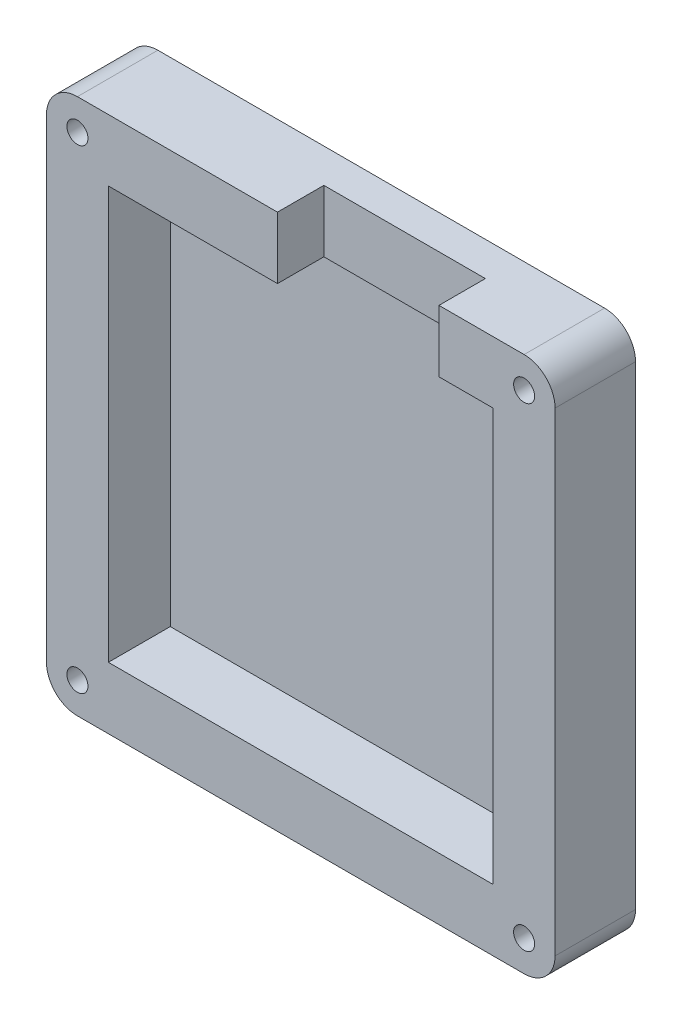
from build123d import *

# Parameters (mm, degrees)
BOSS_EXTRUDE4_START   = 3.1
SKETCH2_R             = 3
SKETCH2_R_2           = 1.7
BOSS_EXTRUDE4_DEPTH   = 9.9
BOSS_EXTRUDE4_2_DEPTH = 9.9
BOSS_EXTRUDE4_3_DEPTH = 9.9
BOSS_EXTRUDE4_4_DEPTH = 9.9
SKETCH2_12_W          = 82.193
SKETCH2_12_H          = 86.675
SKETCH2_12_R          = 3
SKETCH2_12_W_2        = 62.193
SKETCH2_12_H_2        = 66.675
BOSS_EXTRUDE5_DEPTH   = 13
SKETCH2_13_W          = 62.193
SKETCH2_13_H          = 66.675
BOSS_EXTRUDE6_DEPTH   = 3
SKETCH5_W             = 26.09775054
SKETCH5_H             = 10
CUT_EXTRUDE1_DEPTH    = 7.5
FILLET1_R             = 5
SKETCH7_W             = 0.189957265
SKETCH7_H             = 1.546794872
CUT_EXTRUDE2_DEPTH    = 0.2


with BuildPart() as part:
    # Sketch2 → Boss-Extrude4 (new body)
    with BuildSketch(Plane.XY.offset(BOSS_EXTRUDE4_START)):
        with Locations((-36.0965, 38.3375)):
            Circle(SKETCH2_R)
        with Locations((-36.0965, 38.3375)):
            Circle(SKETCH2_R_2, mode=Mode.SUBTRACT)
    extrude(amount=BOSS_EXTRUDE4_DEPTH)



with BuildPart() as body_2:
    # Sketch2 → Boss-Extrude4 2 (new body)
    with BuildSketch(Plane.XY.offset(BOSS_EXTRUDE4_START)):
        with Locations((36.0965, 38.3375)):
            Circle(SKETCH2_R)
        with Locations((36.0965, 38.3375)):
            Circle(SKETCH2_R_2, mode=Mode.SUBTRACT)
    extrude(amount=BOSS_EXTRUDE4_2_DEPTH)


with BuildPart() as body_3:
    # Sketch2 → Boss-Extrude4 3 (new body)
    with BuildSketch(Plane.XY.offset(BOSS_EXTRUDE4_START)):
        with Locations((-36.0965, -38.3375)):
            Circle(SKETCH2_R)
        with Locations((-36.0965, -38.3375)):
            Circle(SKETCH2_R_2, mode=Mode.SUBTRACT)
    extrude(amount=BOSS_EXTRUDE4_3_DEPTH)


with BuildPart() as body_4:
    # Sketch2 → Boss-Extrude4 4 (new body)
    with BuildSketch(Plane.XY.offset(BOSS_EXTRUDE4_START)):
        with Locations((36.0965, -38.3375)):
            Circle(SKETCH2_R)
        with Locations((36.0965, -38.3375)):
            Circle(SKETCH2_R_2, mode=Mode.SUBTRACT)
    extrude(amount=BOSS_EXTRUDE4_4_DEPTH)


with BuildPart() as part_1:
    add(part.part)

    add(body_2.part)  # Boss-Extrude5 merges body 2

    add(body_3.part)  # Boss-Extrude5 merges body 3

    add(body_4.part)  # Boss-Extrude5 merges body 4
    # Sketch2<12> → Boss-Extrude5 (add)
    with BuildSketch(Plane.XY):
        Rectangle(SKETCH2_12_W, SKETCH2_12_H)
        with Locations((-36.0965, -38.3375)):
            Circle(SKETCH2_12_R, mode=Mode.SUBTRACT)
        Rectangle(SKETCH2_12_W_2, SKETCH2_12_H_2, mode=Mode.SUBTRACT)
        with Locations((36.0965, -38.3375)):
            Circle(SKETCH2_12_R, mode=Mode.SUBTRACT)
        with Locations((-36.0965, 38.3375)):
            Circle(SKETCH2_12_R, mode=Mode.SUBTRACT)
        with Locations((36.0965, 38.3375)):
            Circle(SKETCH2_12_R, mode=Mode.SUBTRACT)
    extrude(amount=BOSS_EXTRUDE5_DEPTH)

    # Sketch2<13> → Boss-Extrude6 (add)
    with BuildSketch(Plane.XY):
        Rectangle(SKETCH2_13_W, SKETCH2_13_H)
    extrude(amount=BOSS_EXTRUDE6_DEPTH)

    # Sketch5 → Cut-Extrude1 (cut)
    with BuildSketch(Plane.XY.offset(13)):
        with Locations((9.28237527, 38.3375)):
            Rectangle(SKETCH5_W, SKETCH5_H)
    extrude(amount=-CUT_EXTRUDE1_DEPTH, mode=Mode.SUBTRACT)

    # Fillet1
    fillet1_edges = [part_1.edges().sort_by_distance(p)[0] for p in [
        (-41.0965, -43.3375, 6.5),
        (-41.0965, 43.3375, 6.5),
        (41.0965, -43.3375, 6.5),
        (41.0965, 43.3375, 6.5),
    ]]
    fillet(fillet1_edges, radius=FILLET1_R)

    # Sketch7 → Cut-Extrude2 (cut)
    # profile 1 of 15: a face of its own
    with BuildSketch(Plane(origin=(0, 0, 0), x_dir=(-1, 0, 0), z_dir=(0, 0, -1))):
        with BuildLine():
            Line((0.197612891, 2.170940171), (0.197612891, 0))
            Line((0.197612891, 0), (0.007655626, 0))
            Line((0.007655626, 0), (0.007655626, 0.267551416))
            add(Edge.make_bspline(
                [(0.007655626, 0.267551416), (-0.013764309, 0.243336994), (-0.055565582, 0.196082247), (-0.125379973, 0.134346838), (-0.199383585, 0.083318044), (-0.277217241, 0.042103571), (-0.358810655, 0.011144565), (-0.443982955, -0.010860398), (-0.532768886, -0.025008098), (-0.593397691, -0.026420835), (-0.624121885, -0.027136752)],
                knots=[0, 0, 0, 0, 1.074387032, 2.096679803, 3.090159297, 4.057316773, 5.018401886, 5.985159533, 6.978961417, 8, 8, 8, 8], degree=3))
            add(Edge.make_bspline(
                [(-0.624121885, -0.027136752), (-0.651437743, -0.026395089), (-0.705305824, -0.024932496), (-0.784547218, -0.01358577), (-0.860803007, 0.004636082), (-0.934145248, 0.029976144), (-1.004099355, 0.063589308), (-1.071264271, 0.10383092), (-1.135292042, 0.151752755), (-1.195206734, 0.206536944), (-1.250380373, 0.266042483), (-1.298798381, 0.329509552), (-1.3391681, 0.396663707), (-1.372925959, 0.46665471), (-1.39892851, 0.540021352), (-1.417055422, 0.616509925), (-1.42838893, 0.696029991), (-1.429850918, 0.750180084), (-1.430592237, 0.777637553)],
                knots=[0, 0, 0, 0, 1.033919861, 2.038935746, 3.024066025, 3.998881131, 4.97069526, 5.957263378, 6.95902576, 7.993208707, 9.027059324, 10.027763471, 11.009749337, 11.988697705, 12.965288445, 13.950418724, 14.960734635, 16, 16, 16, 16], degree=3))
            add(Edge.make_bspline(
                [(-1.430592237, 0.777637553), (-1.429834488, 0.804527507), (-1.428336458, 0.857687496), (-1.417176654, 0.935870328), (-1.398410282, 1.011174228), (-1.372074203, 1.083356761), (-1.338303116, 1.152505267), (-1.297222796, 1.218668654), (-1.248830278, 1.282029194), (-1.193039537, 1.341097031), (-1.132602795, 1.395659022), (-1.067948467, 1.443077825), (-1.000684864, 1.484030396), (-0.929768662, 1.516477974), (-0.856249508, 1.542730147), (-0.7794729, 1.560892942), (-0.699758279, 1.571595608), (-0.645637839, 1.57314547), (-0.61818572, 1.573931624)],
                knots=[0, 0, 0, 0, 1.020392517, 2.01726096, 2.990465484, 3.961182959, 4.928053699, 5.906110375, 6.912531644, 7.948652711, 8.985773172, 9.998621852, 10.987621588, 11.969261332, 12.953316658, 13.946091881, 14.958173133, 16, 16, 16, 16], degree=3))
            add(Edge.make_bspline(
                [(-0.61818572, 1.573931624), (-0.586606984, 1.572983904), (-0.524621435, 1.571123635), (-0.433968519, 1.555577403), (-0.348220774, 1.529474139), (-0.266884538, 1.493737983), (-0.190444714, 1.447291815), (-0.118340984, 1.391199273), (-0.05182726, 1.323872856), (-0.0124743, 1.273307761), (0.007655626, 1.247442575)],
                knots=[0, 0, 0, 0, 1.031072012, 2.023879775, 2.993683497, 3.952812103, 4.918022106, 5.908088563, 6.929940113, 8, 8, 8, 8], degree=3))
            Line((0.007655626, 1.247442575), (0.007655626, 2.170940171))
            Line((0.007655626, 2.170940171), (0.197612891, 2.170940171))
        make_face()
        with BuildLine():
            add(Edge.make_bspline(
                [(-0.61564165, 1.383974359), (-0.643408892, 1.382986397), (-0.698217012, 1.381036318), (-0.778676956, 1.365812347), (-0.855671259, 1.34048214), (-0.928814837, 1.305840228), (-0.996952283, 1.262279992), (-1.057847979, 1.209592298), (-1.111999993, 1.149214675), (-1.157543563, 1.08141959), (-1.194670197, 1.008740458), (-1.220775973, 0.932767584), (-1.237993089, 0.85487124), (-1.239752052, 0.802037616), (-1.240634972, 0.775517495)],
                knots=[0, 0, 0, 0, 1.031046209, 2.035121221, 3.029706178, 4.034933723, 5.034054252, 6.02443088, 7.017295772, 8.038157696, 9.050218397, 10.03989886, 11.016116709, 12, 12, 12, 12], degree=3))
            add(Edge.make_bspline(
                [(-1.240634972, 0.775517495), (-1.239507156, 0.749155858), (-1.237255944, 0.696535915), (-1.221078143, 0.618533375), (-1.193936505, 0.542542598), (-1.156899639, 0.469208568), (-1.110522489, 0.401121993), (-1.056766018, 0.339593443), (-0.995110372, 0.286683073), (-0.926816118, 0.242391778), (-0.853877012, 0.206612539), (-0.777172682, 0.181717129), (-0.698145034, 0.1656439), (-0.644410528, 0.16376643), (-0.617337697, 0.162820513)],
                knots=[0, 0, 0, 0, 0.979072187, 1.954306742, 2.945804271, 3.96968567, 4.997920485, 5.998718438, 6.996577872, 8.005894225, 9.015743152, 10.005417472, 10.995077863, 12, 12, 12, 12], degree=3))
            add(Edge.make_bspline(
                [(-0.617337697, 0.162820513), (-0.589853383, 0.163824396), (-0.535189809, 0.165821019), (-0.454491162, 0.181110166), (-0.376177542, 0.206370344), (-0.301315742, 0.24138553), (-0.231576939, 0.284781645), (-0.168985365, 0.335585933), (-0.116059041, 0.394673097), (-0.071190178, 0.459610285), (-0.036007902, 0.530798017), (-0.010380475, 0.60659536), (0.004771172, 0.687004956), (0.006680847, 0.741955997), (0.007655626, 0.770005342)],
                knots=[0, 0, 0, 0, 1.01762866, 2.023962475, 3.030623092, 4.058876274, 5.077231937, 6.066672613, 7.034107872, 8.005628644, 8.981990164, 9.965428785, 10.961468474, 12, 12, 12, 12], degree=3))
            add(Edge.make_bspline(
                [(0.007655626, 0.770005342), (0.007075262, 0.791376316), (0.005932923, 0.833441155), (-0.002794136, 0.895203987), (-0.016676401, 0.954309621), (-0.036238132, 1.0108202), (-0.061935242, 1.064423281), (-0.092927939, 1.115503745), (-0.129761234, 1.163795925), (-0.171842198, 1.20863483), (-0.217904011, 1.249532738), (-0.266644519, 1.286038731), (-0.31864119, 1.316028132), (-0.373019588, 1.34084833), (-0.429874062, 1.360599339), (-0.489667247, 1.373775706), (-0.551763586, 1.382823139), (-0.594124772, 1.383586579), (-0.61564165, 1.383974359)],
                knots=[0, 0, 0, 0, 1.050140795, 2.067009409, 3.05949893, 4.030605086, 5.00011959, 5.97591094, 6.962425594, 7.979863591, 8.993523472, 9.986985069, 10.967611495, 11.937549037, 12.921786183, 13.919465291, 14.943216303, 16, 16, 16, 16], degree=3))
        make_face(mode=Mode.SUBTRACT)
    # profile 2 of 15: a face of its own
    with BuildSketch(Plane(origin=(0, 0, 0), x_dir=(-1, 0, 0), z_dir=(0, 0, -1))):
        with BuildLine():
            Line((2.205732549, 1.546794872), (2.205732549, 0))
            Line((2.205732549, 0), (2.015775284, 0))
            Line((2.015775284, 0), (2.015775284, 0.267551416))
            add(Edge.make_bspline(
                [(2.015775284, 0.267551416), (1.994355349, 0.243336994), (1.952554076, 0.196082247), (1.882739685, 0.134346838), (1.808736073, 0.083318044), (1.730902417, 0.042103571), (1.649309003, 0.011144565), (1.564136703, -0.010860398), (1.475350772, -0.025008098), (1.414721967, -0.026420835), (1.383997773, -0.027136752)],
                knots=[0, 0, 0, 0, 1.074387032, 2.096679803, 3.090159297, 4.057316773, 5.018401886, 5.985159533, 6.978961417, 8, 8, 8, 8], degree=3))
            add(Edge.make_bspline(
                [(1.383997773, -0.027136752), (1.356681916, -0.026395089), (1.302813835, -0.024932496), (1.22357244, -0.01358577), (1.147316651, 0.004636082), (1.07397441, 0.029976144), (1.004020303, 0.063589308), (0.936855387, 0.10383092), (0.872827616, 0.151752755), (0.812912924, 0.206536944), (0.757739285, 0.266042483), (0.709321278, 0.329509552), (0.668951558, 0.396663707), (0.6351937, 0.46665471), (0.609191148, 0.540021352), (0.591064236, 0.616509925), (0.579730728, 0.696029991), (0.57826874, 0.750180084), (0.577527421, 0.777637553)],
                knots=[0, 0, 0, 0, 1.033919861, 2.038935746, 3.024066025, 3.998881131, 4.97069526, 5.957263378, 6.95902576, 7.993208707, 9.027059324, 10.027763471, 11.009749337, 11.988697705, 12.965288445, 13.950418724, 14.960734635, 16, 16, 16, 16], degree=3))
            add(Edge.make_bspline(
                [(0.577527421, 0.777637553), (0.57828517, 0.804527507), (0.5797832, 0.857687496), (0.590943004, 0.935870328), (0.609709376, 1.011174228), (0.636045455, 1.083356761), (0.669816542, 1.152505267), (0.710896862, 1.218668654), (0.75928938, 1.282029194), (0.815080121, 1.341097031), (0.875516863, 1.395659022), (0.940171191, 1.443077825), (1.007434795, 1.484030396), (1.078350996, 1.516477974), (1.15187015, 1.542730147), (1.228646758, 1.560892942), (1.308361379, 1.571595608), (1.362481819, 1.57314547), (1.389933938, 1.573931624)],
                knots=[0, 0, 0, 0, 1.020392517, 2.01726096, 2.990465484, 3.961182959, 4.928053699, 5.906110375, 6.912531644, 7.948652711, 8.985773172, 9.998621852, 10.987621588, 11.969261332, 12.953316658, 13.946091881, 14.958173133, 16, 16, 16, 16], degree=3))
            add(Edge.make_bspline(
                [(1.389933938, 1.573931624), (1.421502424, 1.573062127), (1.483406736, 1.571357083), (1.573956532, 1.55716772), (1.659617716, 1.533195885), (1.741051538, 1.500588636), (1.817965572, 1.457258214), (1.889631663, 1.402599857), (1.956799836, 1.336958282), (1.995734584, 1.286539013), (2.015775284, 1.260586939)],
                knots=[0, 0, 0, 0, 1.038897134, 2.037228247, 3.008116434, 3.962042015, 4.918381754, 5.904844433, 6.921570401, 8, 8, 8, 8], degree=3))
            Line((2.015775284, 1.260586939), (2.015775284, 1.546794872))
            Line((2.015775284, 1.546794872), (2.205732549, 1.546794872))
        make_face()
        with BuildLine():
            add(Edge.make_bspline(
                [(1.392478008, 1.383974359), (1.364710766, 1.382986397), (1.309902646, 1.381036318), (1.229442702, 1.365812347), (1.152448399, 1.34048214), (1.079304821, 1.305840228), (1.011167376, 1.262279992), (0.950271679, 1.209592298), (0.896119665, 1.149214675), (0.850576095, 1.08141959), (0.813449462, 1.008740458), (0.787343685, 0.932767584), (0.770126569, 0.85487124), (0.768367606, 0.802037616), (0.767484686, 0.775517495)],
                knots=[0, 0, 0, 0, 1.031046209, 2.035121221, 3.029706178, 4.034933723, 5.034054252, 6.02443088, 7.017295772, 8.038157696, 9.050218397, 10.03989886, 11.016116709, 12, 12, 12, 12], degree=3))
            add(Edge.make_bspline(
                [(0.767484686, 0.775517495), (0.768612502, 0.749155858), (0.770863714, 0.696535915), (0.787041515, 0.618533375), (0.814183153, 0.542542598), (0.85122002, 0.469208568), (0.897597169, 0.401121993), (0.95135364, 0.339593443), (1.013009286, 0.286683073), (1.08130354, 0.242391778), (1.154242646, 0.206612539), (1.230946976, 0.181717129), (1.309974624, 0.1656439), (1.363709131, 0.16376643), (1.390781961, 0.162820513)],
                knots=[0, 0, 0, 0, 0.979072187, 1.954306742, 2.945804271, 3.96968567, 4.997920485, 5.998718438, 6.996577872, 8.005894225, 9.015743152, 10.005417472, 10.995077863, 12, 12, 12, 12], degree=3))
            add(Edge.make_bspline(
                [(1.390781961, 0.162820513), (1.418266275, 0.163824396), (1.472929849, 0.165821019), (1.553628496, 0.181110166), (1.631942116, 0.206370344), (1.706803916, 0.24138553), (1.776542719, 0.284781645), (1.839134293, 0.335585933), (1.892060617, 0.394673097), (1.936929481, 0.459610285), (1.972111756, 0.530798017), (1.997739183, 0.60659536), (2.01289083, 0.687004956), (2.014800505, 0.741955997), (2.015775284, 0.770005342)],
                knots=[0, 0, 0, 0, 1.01762866, 2.023962475, 3.030623092, 4.058876274, 5.077231937, 6.066672613, 7.034107872, 8.005628644, 8.981990164, 9.965428785, 10.961468474, 12, 12, 12, 12], degree=3))
            add(Edge.make_bspline(
                [(2.015775284, 0.770005342), (2.01519492, 0.791376316), (2.014052581, 0.833441155), (2.005325522, 0.895203987), (1.991443257, 0.954309621), (1.971881526, 1.0108202), (1.946184416, 1.064423281), (1.915191719, 1.115503745), (1.878358424, 1.163795925), (1.83627746, 1.20863483), (1.790215647, 1.249532738), (1.741475139, 1.286038731), (1.689478468, 1.316028132), (1.63510007, 1.34084833), (1.578245596, 1.360599339), (1.518452412, 1.373775706), (1.456356072, 1.382823139), (1.413994886, 1.383586579), (1.392478008, 1.383974359)],
                knots=[0, 0, 0, 0, 1.050140795, 2.067009409, 3.05949893, 4.030605086, 5.00011959, 5.97591094, 6.962425594, 7.979863591, 8.993523472, 9.986985069, 10.967611495, 11.937549037, 12.921786183, 13.919465291, 14.943216303, 16, 16, 16, 16], degree=3))
        make_face(mode=Mode.SUBTRACT)
    # profile 3 of 15: a face of its own
    with BuildSketch(Plane(origin=(0, 0, 0), x_dir=(-1, 0, 0), z_dir=(0, 0, -1))):
        with BuildLine():
            Line((2.585647079, 1.546794872), (2.775604344, 1.546794872))
            Line((2.775604344, 1.546794872), (2.775604344, 1.319100561))
            add(Edge.make_bspline(
                [(2.775604344, 1.319100561), (2.789628022, 1.34030099), (2.816448197, 1.380846647), (2.861026968, 1.434470462), (2.906688507, 1.478869086), (2.953651406, 1.514249785), (3.002261019, 1.540746291), (3.051450508, 1.560154936), (3.101993769, 1.571631693), (3.135958361, 1.573163953), (3.152974803, 1.573931624)],
                knots=[0, 0, 0, 0, 1.2804753, 2.448899062, 3.506932113, 4.484331642, 5.4025378, 6.288909075, 7.142734305, 8, 8, 8, 8], degree=3))
            add(Edge.make_bspline(
                [(3.152974803, 1.573931624), (3.166174534, 1.573211639), (3.193333838, 1.571730223), (3.234447118, 1.561321772), (3.27680673, 1.54470411), (3.304107126, 1.529076928), (3.318339387, 1.520930155)],
                knots=[0, 0, 0, 0, 0.901110191, 1.854092781, 2.881294221, 4, 4, 4, 4], degree=3))
            Line((3.318339387, 1.520930155), (3.214032496, 1.356413595))
            add(Edge.make_bspline(
                [(3.214032496, 1.356413595), (3.204895135, 1.360489851), (3.187550676, 1.368227366), (3.162178153, 1.377384677), (3.138785154, 1.382776683), (3.123881668, 1.383593545), (3.116933804, 1.383974359)],
                knots=[0, 0, 0, 0, 1.180555205, 2.24091978, 3.179933427, 4, 4, 4, 4], degree=3))
            add(Edge.make_bspline(
                [(3.116933804, 1.383974359), (3.101690337, 1.382958336), (3.070598082, 1.380885945), (3.024947932, 1.36459438), (2.980650813, 1.338271973), (2.945470808, 1.309079443), (2.918230969, 1.280929109), (2.898793785, 1.256346503), (2.880963743, 1.228782283), (2.863927467, 1.198707665), (2.84840547, 1.165609139), (2.833918598, 1.129817386), (2.820820143, 1.091290951), (2.813351186, 1.064450094), (2.809525284, 1.050701122)],
                knots=[0, 0, 0, 0, 1.125678352, 2.296057538, 3.5422874, 4.923748041, 5.663163013, 6.437101912, 7.23742474, 8.08941207, 8.991984279, 9.93940061, 10.944477711, 12, 12, 12, 12], degree=3))
            add(Edge.make_bspline(
                [(2.809525284, 1.050701122), (2.806663313, 1.03843826), (2.800324264, 1.011276952), (2.79416081, 0.965709035), (2.788071149, 0.911870917), (2.783779385, 0.84961274), (2.779801236, 0.779089976), (2.777557519, 0.70019519), (2.775680858, 0.612847401), (2.775630622, 0.551781959), (2.775604344, 0.519838408)],
                knots=[0, 0, 0, 0, 0.566838948, 1.255505196, 2.06880316, 3.007127437, 4.065329342, 5.249902469, 6.561414163, 8, 8, 8, 8], degree=3))
            Line((2.775604344, 0.519838408), (2.775604344, 0))
            Line((2.775604344, 0), (2.585647079, 0))
            Line((2.585647079, 0), (2.585647079, 1.546794872))
        make_face()
    # profile 4 of 15: a face of its own
    with BuildSketch(Plane(origin=(0, 0, 0), x_dir=(-1, 0, 0), z_dir=(0, 0, -1))):
        with BuildLine():
            Line((4.240988959, 1.353869525), (4.112089387, 1.221153846))
            add(Edge.make_bspline(
                [(4.112089387, 1.221153846), (4.100967511, 1.234043225), (4.079525843, 1.25889243), (4.045519186, 1.292116275), (4.011638244, 1.320018138), (3.978346819, 1.343574981), (3.944807771, 1.361384703), (3.911414682, 1.374383976), (3.878132978, 1.382428402), (3.855886186, 1.383465229), (3.844961983, 1.383974359)],
                knots=[0, 0, 0, 0, 1.26578478, 2.440284043, 3.530471711, 4.527705817, 5.468200915, 6.346673037, 7.188140097, 8, 8, 8, 8], degree=3))
            add(Edge.make_bspline(
                [(3.844961983, 1.383974359), (3.831572923, 1.383324317), (3.805225149, 1.382045126), (3.767472392, 1.369276527), (3.732426062, 1.349676957), (3.702093031, 1.321876909), (3.676398101, 1.289967089), (3.657642208, 1.254288359), (3.646172303, 1.215917399), (3.644718013, 1.189289819), (3.643980412, 1.175784589)],
                knots=[0, 0, 0, 0, 0.99966794, 1.967205029, 2.953328237, 3.988086729, 5.028030931, 6.008226631, 6.989793394, 8, 8, 8, 8], degree=3))
            add(Edge.make_bspline(
                [(3.643980412, 1.175784589), (3.644652189, 1.163561114), (3.645993849, 1.139148624), (3.656423984, 1.103136241), (3.673034418, 1.068025556), (3.688558774, 1.046518465), (3.69655787, 1.035436699)],
                knots=[0, 0, 0, 0, 0.960159726, 1.917612774, 2.927026955, 4, 4, 4, 4], degree=3))
            add(Edge.make_bspline(
                [(3.69655787, 1.035436699), (3.701373887, 1.029519355), (3.711624174, 1.016925034), (3.730860752, 0.999445085), (3.752645789, 0.980127628), (3.778844037, 0.960813446), (3.808326802, 0.94047426), (3.841733417, 0.919911065), (3.878003712, 0.897556389), (3.90397056, 0.883378087), (3.917467992, 0.87600828)],
                knots=[0, 0, 0, 0, 0.66740084, 1.420478572, 2.27185888, 3.217733974, 4.268547843, 5.408967954, 6.65319498, 8, 8, 8, 8], degree=3))
            add(Edge.make_bspline(
                [(3.917467992, 0.87600828), (3.933925727, 0.866788743), (3.965716651, 0.848979635), (4.010887992, 0.821336147), (4.051883012, 0.793860953), (4.089049058, 0.766847887), (4.121671009, 0.739541153), (4.15073862, 0.712987414), (4.175526869, 0.686384356), (4.18940853, 0.66779814), (4.196043714, 0.658914263)],
                knots=[0, 0, 0, 0, 1.27191281, 2.456916733, 3.569705269, 4.599008579, 5.553216877, 6.436649441, 7.252746552, 8, 8, 8, 8], degree=3))
            add(Edge.make_bspline(
                [(4.196043714, 0.658914263), (4.207056747, 0.640973343), (4.228974727, 0.605267583), (4.251990917, 0.546473581), (4.26533213, 0.484116277), (4.267184045, 0.441461078), (4.268125711, 0.419771635)],
                knots=[0, 0, 0, 0, 0.995354457, 1.980940102, 2.973342416, 4, 4, 4, 4], degree=3))
            add(Edge.make_bspline(
                [(4.268125711, 0.419771635), (4.267690565, 0.404489818), (4.266833061, 0.374375328), (4.260871277, 0.330025216), (4.250617554, 0.287610508), (4.236651331, 0.246670979), (4.21779221, 0.207991048), (4.195689495, 0.170594841), (4.16915562, 0.135291302), (4.138862264, 0.102126788), (4.105693799, 0.071836836), (4.070311515, 0.045212825), (4.032671841, 0.02309406), (3.993043728, 0.004790732), (3.951337137, -0.009764834), (3.907545548, -0.019841698), (3.861808158, -0.025872844), (3.830705369, -0.026710122), (3.814857148, -0.027136752)],
                knots=[0, 0, 0, 0, 1.032770009, 2.035186124, 3.017557409, 3.978232242, 4.952395191, 5.920591857, 6.910227898, 7.931268572, 8.952309245, 9.941945286, 10.918353717, 11.897095711, 12.887975737, 13.898235213, 14.929059601, 16, 16, 16, 16], degree=3))
            add(Edge.make_bspline(
                [(3.814857148, -0.027136752), (3.793468428, -0.026536405), (3.750988182, -0.025344052), (3.688159637, -0.014152291), (3.62676375, 0.003262066), (3.567265133, 0.02728075), (3.510994388, 0.057609991), (3.459510447, 0.093933438), (3.412634468, 0.135051199), (3.385953417, 0.166567102), (3.372612891, 0.182325053)],
                knots=[0, 0, 0, 0, 1.013940152, 2.01379169, 3.017749504, 4.037548394, 5.051665909, 6.043208538, 7.021604269, 8, 8, 8, 8], degree=3))
            Line((3.372612891, 0.182325053), (3.498544381, 0.325641026))
            add(Edge.make_bspline(
                [(3.498544381, 0.325641026), (3.510501983, 0.312726478), (3.533683603, 0.287689673), (3.570756244, 0.254352572), (3.608480929, 0.226411803), (3.646480954, 0.203041738), (3.685318821, 0.185034709), (3.724776882, 0.17238394), (3.764774882, 0.164253405), (3.791639697, 0.16329892), (3.805104878, 0.162820513)],
                knots=[0, 0, 0, 0, 1.179806542, 2.287233372, 3.337373186, 4.324005949, 5.273901747, 6.200048787, 7.097828587, 8, 8, 8, 8], degree=3))
            add(Edge.make_bspline(
                [(3.805104878, 0.162820513), (3.823440005, 0.163649535), (3.859263767, 0.165269307), (3.91057404, 0.179975358), (3.957950257, 0.2030349), (3.999088185, 0.235743265), (4.034105206, 0.273816397), (4.059461768, 0.316702555), (4.075352598, 0.363143102), (4.077218893, 0.395335971), (4.078168446, 0.411715411)],
                knots=[0, 0, 0, 0, 1.072336372, 2.095165389, 3.102688358, 4.141489647, 5.156069229, 6.117746104, 7.042326257, 8, 8, 8, 8], degree=3))
            add(Edge.make_bspline(
                [(4.078168446, 0.411715411), (4.077511497, 0.425207419), (4.076214438, 0.451845582), (4.066028269, 0.490399359), (4.04993383, 0.526968877), (4.034086257, 0.548371187), (4.026015001, 0.559271501)],
                knots=[0, 0, 0, 0, 1.013901739, 2.00181326, 2.98231254, 4, 4, 4, 4], degree=3))
            add(Edge.make_bspline(
                [(4.026015001, 0.559271501), (4.021163362, 0.564735744), (4.010594741, 0.576638838), (3.991208953, 0.593829243), (3.967997065, 0.612357998), (3.940698014, 0.631910912), (3.909256768, 0.652230068), (3.873545894, 0.673208867), (3.834054608, 0.69584373), (3.806132369, 0.710853712), (3.791536502, 0.71869992)],
                knots=[0, 0, 0, 0, 0.615000592, 1.339693406, 2.178160186, 3.116406724, 4.166410947, 5.330106347, 6.604359322, 8, 8, 8, 8], degree=3))
            add(Edge.make_bspline(
                [(3.791536502, 0.71869992), (3.775784486, 0.727492633), (3.745236301, 0.744544509), (3.701967225, 0.771103282), (3.662931444, 0.798116348), (3.627189668, 0.824068398), (3.595644679, 0.850327731), (3.568420748, 0.876923497), (3.544446042, 0.902783108), (3.531173083, 0.921105759), (3.52483311, 0.929857772)],
                knots=[0, 0, 0, 0, 1.262093308, 2.447601706, 3.550203992, 4.582594899, 5.537233252, 6.418365656, 7.244515135, 8, 8, 8, 8], degree=3))
            add(Edge.make_bspline(
                [(3.52483311, 0.929857772), (3.513868414, 0.94748393), (3.49193519, 0.982742405), (3.470638384, 1.041592074), (3.4559995, 1.103546942), (3.454691769, 1.146295659), (3.454023147, 1.168152377)],
                knots=[0, 0, 0, 0, 0.985009483, 1.970363186, 2.962279964, 4, 4, 4, 4], degree=3))
            add(Edge.make_bspline(
                [(3.454023147, 1.168152377), (3.454346208, 1.182440118), (3.454978484, 1.210403251), (3.460024649, 1.251490061), (3.469212017, 1.290526325), (3.480735708, 1.328098285), (3.496751621, 1.363478123), (3.515889858, 1.397137641), (3.538379396, 1.429030316), (3.564289387, 1.458665543), (3.592777691, 1.485583088), (3.623556909, 1.50904702), (3.655934807, 1.529068482), (3.69004847, 1.545859794), (3.726225613, 1.55856063), (3.764213361, 1.567303906), (3.803934822, 1.573143005), (3.831089312, 1.573664965), (3.844961983, 1.573931624)],
                knots=[0, 0, 0, 0, 1.087655834, 2.128696564, 3.144119009, 4.137814668, 5.115653402, 6.093965665, 7.082169637, 8.081268856, 9.086088321, 10.061021666, 11.022561449, 11.980240094, 12.950172527, 13.934149372, 14.944599409, 16, 16, 16, 16], degree=3))
            add(Edge.make_bspline(
                [(3.844961983, 1.573931624), (3.861406707, 1.573263761), (3.894604641, 1.571915506), (3.944409582, 1.561207779), (3.994141174, 1.543589187), (4.0439272, 1.519255846), (4.093402947, 1.487767783), (4.143003617, 1.44971054), (4.193324664, 1.405334494), (4.224745863, 1.371407819), (4.240988959, 1.353869525)],
                knots=[0, 0, 0, 0, 0.845714091, 1.707292901, 2.609013841, 3.555613372, 4.552488639, 5.621697636, 6.770543573, 8, 8, 8, 8], degree=3))
        make_face()
    # profile 5 of 15: a face of its own
    with BuildSketch(Plane(origin=(0, 0, 0), x_dir=(-1, 0, 0), z_dir=(0, 0, -1))):
        with BuildLine():
            Line((4.648040241, 2.170940171), (4.837997506, 2.170940171))
            Line((4.837997506, 2.170940171), (4.837997506, 1.254650775))
            add(Edge.make_bspline(
                [(4.837997506, 1.254650775), (4.858388446, 1.280137849), (4.89809065, 1.32976249), (4.964914492, 1.39450902), (5.033537353, 1.450630091), (5.106329404, 1.495304129), (5.181955195, 1.530595944), (5.260733685, 1.555625615), (5.342679511, 1.571017469), (5.398332816, 1.57295175), (5.426525818, 1.573931624)],
                knots=[0, 0, 0, 0, 1.125788106, 2.19196713, 3.20547328, 4.180437432, 5.132270164, 6.079753143, 7.027236121, 8, 8, 8, 8], degree=3))
            add(Edge.make_bspline(
                [(5.426525818, 1.573931624), (5.455149437, 1.572876054), (5.511172763, 1.57081005), (5.592743933, 1.554473386), (5.668920272, 1.526559126), (5.739475329, 1.488358115), (5.802869312, 1.440779786), (5.859021313, 1.385848342), (5.904886939, 1.322182687), (5.936092119, 1.263365809), (5.956396037, 1.211030467), (5.969248332, 1.166135053), (5.980145657, 1.116107991), (5.989640259, 1.060975034), (5.995968234, 1.000471526), (6.001051027, 0.934870429), (6.004665359, 0.864175505), (6.004805424, 0.815238021), (6.004877848, 0.789933894)],
                knots=[0, 0, 0, 0, 1.235656852, 2.418478516, 3.575258207, 4.727955599, 5.870717718, 6.98870536, 8.107142894, 9.245821548, 9.854588956, 10.528768408, 11.260415777, 12.065282286, 12.943670737, 13.886611085, 14.907229059, 16, 16, 16, 16], degree=3))
            Line((6.004877848, 0.789933894), (6.004877848, 0))
            Line((6.004877848, 0), (5.814920583, 0))
            Line((5.814920583, 0), (5.814920583, 0.727604167))
            add(Edge.make_bspline(
                [(5.814920583, 0.727604167), (5.814805495, 0.748663591), (5.814585351, 0.788946685), (5.813857614, 0.846620474), (5.812233093, 0.898930041), (5.809607927, 0.94570774), (5.806847003, 0.987018786), (5.803047093, 1.022803186), (5.798626141, 1.053110088), (5.794653593, 1.071352506), (5.792871972, 1.079533921)],
                knots=[0, 0, 0, 0, 1.430932559, 2.737130458, 3.918967929, 4.986496826, 5.920444988, 6.731744033, 7.431208747, 8, 8, 8, 8], degree=3))
            add(Edge.make_bspline(
                [(5.792871972, 1.079533921), (5.785963024, 1.103539499), (5.772680611, 1.149690084), (5.741808739, 1.212381161), (5.703249718, 1.265832885), (5.65617066, 1.309323907), (5.601404411, 1.343439457), (5.538593862, 1.367066163), (5.468330163, 1.381730262), (5.418829511, 1.38320546), (5.39302889, 1.383974359)],
                knots=[0, 0, 0, 0, 1.090059168, 2.095632401, 3.037101401, 3.955032261, 4.878929692, 5.839099886, 6.873700383, 8, 8, 8, 8], degree=3))
            add(Edge.make_bspline(
                [(5.39302889, 1.383974359), (5.377747903, 1.383686597), (5.347507225, 1.383117125), (5.302664937, 1.377399767), (5.25916498, 1.36805697), (5.216588424, 1.355414702), (5.175837633, 1.338211925), (5.135724789, 1.318297001), (5.097386387, 1.293920104), (5.060141631, 1.266569283), (5.02547817, 1.236288999), (4.993227962, 1.204329174), (4.964478585, 1.17029622), (4.938432342, 1.134736149), (4.915948331, 1.097161208), (4.896321943, 1.057933739), (4.879669403, 1.017002156), (4.871394632, 0.988593428), (4.867254317, 0.974379006)],
                knots=[0, 0, 0, 0, 1.024319606, 2.027102035, 3.025350316, 4.005802111, 5.00026367, 5.987881639, 7.005602596, 8.042517216, 9.083927026, 10.089214625, 11.084353441, 12.06828073, 13.041928858, 14.016821737, 15.00770877, 16, 16, 16, 16], degree=3))
            add(Edge.make_bspline(
                [(4.867254317, 0.974379006), (4.864871902, 0.964085384), (4.859680325, 0.941654313), (4.854047069, 0.904658412), (4.849004687, 0.861668082), (4.844741993, 0.812748529), (4.842127555, 0.757720492), (4.839310428, 0.696959483), (4.838261762, 0.630084899), (4.838088224, 0.583581426), (4.837997506, 0.559271501)],
                knots=[0, 0, 0, 0, 0.607992626, 1.324890765, 2.152360218, 3.099583803, 4.150613268, 5.323148443, 6.60066238, 8, 8, 8, 8], degree=3))
            Line((4.837997506, 0.559271501), (4.837997506, 0))
            Line((4.837997506, 0), (4.648040241, 0))
            Line((4.648040241, 0), (4.648040241, 2.170940171))
        make_face()
    # profile 6 of 15: a face of its own
    with BuildSketch(Plane(origin=(0, 0, 0), x_dir=(-1, 0, 0), z_dir=(0, 0, -1))):
        Polygon((6.54506882, 1.51965812), (6.413201165, 1.51965812), (6.384792378, 2.170940171), (6.574749643, 2.170940171), align=None)
    # profile 7 of 15: a face of its own
    with BuildSketch(Plane(origin=(0, 0, 0), x_dir=(-1, 0, 0), z_dir=(0, 0, -1))):
        with BuildLine():
            Line((7.741629985, 1.353869525), (7.612730412, 1.221153846))
            add(Edge.make_bspline(
                [(7.612730412, 1.221153846), (7.601608536, 1.234043225), (7.580166869, 1.25889243), (7.546160211, 1.292116275), (7.51227927, 1.320018138), (7.478987845, 1.343574981), (7.445448796, 1.361384703), (7.412055708, 1.374383976), (7.378774004, 1.382428402), (7.356527211, 1.383465229), (7.345603008, 1.383974359)],
                knots=[0, 0, 0, 0, 1.26578478, 2.440284043, 3.530471711, 4.527705817, 5.468200915, 6.346673037, 7.188140097, 8, 8, 8, 8], degree=3))
            add(Edge.make_bspline(
                [(7.345603008, 1.383974359), (7.332213949, 1.383324317), (7.305866175, 1.382045126), (7.268113418, 1.369276527), (7.233067087, 1.349676957), (7.202734057, 1.321876909), (7.177039126, 1.289967089), (7.158283233, 1.254288359), (7.146813329, 1.215917399), (7.145359039, 1.189289819), (7.144621438, 1.175784589)],
                knots=[0, 0, 0, 0, 0.99966794, 1.967205029, 2.953328237, 3.988086729, 5.028030931, 6.008226631, 6.989793394, 8, 8, 8, 8], degree=3))
            add(Edge.make_bspline(
                [(7.144621438, 1.175784589), (7.145293215, 1.163561114), (7.146634875, 1.139148624), (7.15706501, 1.103136241), (7.173675444, 1.068025556), (7.189199799, 1.046518465), (7.197198895, 1.035436699)],
                knots=[0, 0, 0, 0, 0.960159726, 1.917612774, 2.927026955, 4, 4, 4, 4], degree=3))
            add(Edge.make_bspline(
                [(7.197198895, 1.035436699), (7.202014913, 1.029519355), (7.212265199, 1.016925034), (7.231501778, 0.999445085), (7.253286815, 0.980127628), (7.279485063, 0.960813446), (7.308967828, 0.94047426), (7.342374442, 0.919911065), (7.378644738, 0.897556389), (7.404611585, 0.883378087), (7.418109018, 0.87600828)],
                knots=[0, 0, 0, 0, 0.66740084, 1.420478572, 2.27185888, 3.217733974, 4.268547843, 5.408967954, 6.65319498, 8, 8, 8, 8], degree=3))
            add(Edge.make_bspline(
                [(7.418109018, 0.87600828), (7.434566753, 0.866788743), (7.466357677, 0.848979635), (7.511529017, 0.821336147), (7.552524037, 0.793860953), (7.589690084, 0.766847887), (7.622312035, 0.739541153), (7.651379645, 0.712987414), (7.676167895, 0.686384356), (7.690049555, 0.66779814), (7.696684739, 0.658914263)],
                knots=[0, 0, 0, 0, 1.27191281, 2.456916733, 3.569705269, 4.599008579, 5.553216877, 6.436649441, 7.252746552, 8, 8, 8, 8], degree=3))
            add(Edge.make_bspline(
                [(7.696684739, 0.658914263), (7.707697772, 0.640973343), (7.729615753, 0.605267583), (7.752631942, 0.546473581), (7.765973156, 0.484116277), (7.76782507, 0.441461078), (7.768766737, 0.419771635)],
                knots=[0, 0, 0, 0, 0.995354457, 1.980940102, 2.973342416, 4, 4, 4, 4], degree=3))
            add(Edge.make_bspline(
                [(7.768766737, 0.419771635), (7.76833159, 0.404489818), (7.767474086, 0.374375328), (7.761512303, 0.330025216), (7.751258579, 0.287610508), (7.737292357, 0.246670979), (7.718433236, 0.207991048), (7.696330521, 0.170594841), (7.669796645, 0.135291302), (7.63950329, 0.102126788), (7.606334824, 0.071836836), (7.570952541, 0.045212825), (7.533312867, 0.02309406), (7.493684754, 0.004790732), (7.451978163, -0.009764834), (7.408186573, -0.019841698), (7.362449184, -0.025872844), (7.331346395, -0.026710122), (7.315498174, -0.027136752)],
                knots=[0, 0, 0, 0, 1.032770009, 2.035186124, 3.017557409, 3.978232242, 4.952395191, 5.920591857, 6.910227898, 7.931268572, 8.952309245, 9.941945286, 10.918353717, 11.897095711, 12.887975737, 13.898235213, 14.929059601, 16, 16, 16, 16], degree=3))
            add(Edge.make_bspline(
                [(7.315498174, -0.027136752), (7.294109454, -0.026536405), (7.251629207, -0.025344052), (7.188800663, -0.014152291), (7.127404776, 0.003262066), (7.067906158, 0.02728075), (7.011635413, 0.057609991), (6.960151473, 0.093933438), (6.913275493, 0.135051199), (6.886594442, 0.166567102), (6.873253917, 0.182325053)],
                knots=[0, 0, 0, 0, 1.013940152, 2.01379169, 3.017749504, 4.037548394, 5.051665909, 6.043208538, 7.021604269, 8, 8, 8, 8], degree=3))
            Line((6.873253917, 0.182325053), (6.999185407, 0.325641026))
            add(Edge.make_bspline(
                [(6.999185407, 0.325641026), (7.011143009, 0.312726478), (7.034324629, 0.287689673), (7.071397269, 0.254352572), (7.109121955, 0.226411803), (7.14712198, 0.203041738), (7.185959846, 0.185034709), (7.225417908, 0.17238394), (7.265415907, 0.164253405), (7.292280723, 0.16329892), (7.305745904, 0.162820513)],
                knots=[0, 0, 0, 0, 1.179806542, 2.287233372, 3.337373186, 4.324005949, 5.273901747, 6.200048787, 7.097828587, 8, 8, 8, 8], degree=3))
            add(Edge.make_bspline(
                [(7.305745904, 0.162820513), (7.32408103, 0.163649535), (7.359904792, 0.165269307), (7.411215065, 0.179975358), (7.458591282, 0.2030349), (7.49972921, 0.235743265), (7.534746231, 0.273816397), (7.560102794, 0.316702555), (7.575993624, 0.363143102), (7.577859918, 0.395335971), (7.578809472, 0.411715411)],
                knots=[0, 0, 0, 0, 1.072336372, 2.095165389, 3.102688358, 4.141489647, 5.156069229, 6.117746104, 7.042326257, 8, 8, 8, 8], degree=3))
            add(Edge.make_bspline(
                [(7.578809472, 0.411715411), (7.578152523, 0.425207419), (7.576855464, 0.451845582), (7.566669295, 0.490399359), (7.550574855, 0.526968877), (7.534727282, 0.548371187), (7.526656027, 0.559271501)],
                knots=[0, 0, 0, 0, 1.013901739, 2.00181326, 2.98231254, 4, 4, 4, 4], degree=3))
            add(Edge.make_bspline(
                [(7.526656027, 0.559271501), (7.521804388, 0.564735744), (7.511235767, 0.576638838), (7.491849978, 0.593829243), (7.46863809, 0.612357998), (7.441339039, 0.631910912), (7.409897793, 0.652230068), (7.37418692, 0.673208867), (7.334695634, 0.69584373), (7.306773395, 0.710853712), (7.292177528, 0.71869992)],
                knots=[0, 0, 0, 0, 0.615000592, 1.339693406, 2.178160186, 3.116406724, 4.166410947, 5.330106347, 6.604359322, 8, 8, 8, 8], degree=3))
            add(Edge.make_bspline(
                [(7.292177528, 0.71869992), (7.276425512, 0.727492633), (7.245877327, 0.744544509), (7.202608251, 0.771103282), (7.16357247, 0.798116348), (7.127830694, 0.824068398), (7.096285705, 0.850327731), (7.069061774, 0.876923497), (7.045087067, 0.902783108), (7.031814109, 0.921105759), (7.025474136, 0.929857772)],
                knots=[0, 0, 0, 0, 1.262093308, 2.447601706, 3.550203992, 4.582594899, 5.537233252, 6.418365656, 7.244515135, 8, 8, 8, 8], degree=3))
            add(Edge.make_bspline(
                [(7.025474136, 0.929857772), (7.01450944, 0.94748393), (6.992576216, 0.982742405), (6.97127941, 1.041592074), (6.956640526, 1.103546942), (6.955332794, 1.146295659), (6.954664173, 1.168152377)],
                knots=[0, 0, 0, 0, 0.985009483, 1.970363186, 2.962279964, 4, 4, 4, 4], degree=3))
            add(Edge.make_bspline(
                [(6.954664173, 1.168152377), (6.954987234, 1.182440118), (6.95561951, 1.210403251), (6.960665675, 1.251490061), (6.969853043, 1.290526325), (6.981376734, 1.328098285), (6.997392646, 1.363478123), (7.016530884, 1.397137641), (7.039020422, 1.429030316), (7.064930412, 1.458665543), (7.093418717, 1.485583088), (7.124197935, 1.50904702), (7.156575833, 1.529068482), (7.190689496, 1.545859794), (7.226866639, 1.55856063), (7.264854387, 1.567303906), (7.304575847, 1.573143005), (7.331730338, 1.573664965), (7.345603008, 1.573931624)],
                knots=[0, 0, 0, 0, 1.087655834, 2.128696564, 3.144119009, 4.137814668, 5.115653402, 6.093965665, 7.082169637, 8.081268856, 9.086088321, 10.061021666, 11.022561449, 11.980240094, 12.950172527, 13.934149372, 14.944599409, 16, 16, 16, 16], degree=3))
            add(Edge.make_bspline(
                [(7.345603008, 1.573931624), (7.362047733, 1.573263761), (7.395245667, 1.571915506), (7.445050607, 1.561207779), (7.4947822, 1.543589187), (7.544568226, 1.519255846), (7.594043972, 1.487767783), (7.643644643, 1.44971054), (7.69396569, 1.405334494), (7.725386888, 1.371407819), (7.741629985, 1.353869525)],
                knots=[0, 0, 0, 0, 0.845714091, 1.707292901, 2.609013841, 3.555613372, 4.552488639, 5.621697636, 6.770543573, 8, 8, 8, 8], degree=3))
        make_face()
    # profile 8 of 15: a face of its own
    with BuildSketch(Plane(origin=(0, 0, 0), x_dir=(-1, 0, 0), z_dir=(0, 0, -1))):
        Polygon((9.152741096, 2.170940171), (9.342698361, 2.170940171), (9.342698361, 1.546794872), (9.614065882, 1.546794872), (9.614065882, 1.356837607), (9.342698361, 1.356837607), (9.342698361, 0), (9.152741096, 0), (9.152741096, 1.356837607), (8.881373575, 1.356837607), (8.881373575, 1.546794872), (9.152741096, 1.546794872), align=None)
    # profile 9 of 15: a face of its own
    with BuildSketch(Plane(origin=(0, 0, 0), x_dir=(-1, 0, 0), z_dir=(0, 0, -1))):
        with BuildLine():
            Line((11.209198094, 0.488461538), (11.377954771, 0.399843082))
            add(Edge.make_bspline(
                [(11.377954771, 0.399843082), (11.364506926, 0.375989258), (11.338342743, 0.329579163), (11.293348005, 0.26581799), (11.246181371, 0.208457705), (11.194713733, 0.159030723), (11.140484927, 0.1159406), (11.083194227, 0.078241058), (11.02254337, 0.046117001), (10.958529489, 0.019052377), (10.890614998, -0.001757175), (10.818635319, -0.016455441), (10.742452558, -0.025540942), (10.690233678, -0.026596337), (10.663494969, -0.027136752)],
                knots=[0, 0, 0, 0, 1.120438281, 2.179929193, 3.190490725, 4.156257408, 5.095198341, 6.022838206, 6.959905092, 7.901321166, 8.864066838, 9.862729781, 10.905609505, 12, 12, 12, 12], degree=3))
            add(Edge.make_bspline(
                [(10.663494969, -0.027136752), (10.633775773, -0.026442984), (10.575802231, -0.025089644), (10.491413908, -0.013422296), (10.411960641, 0.005610987), (10.337446896, 0.032199672), (10.268055153, 0.06692953), (10.203647493, 0.109238359), (10.143885209, 0.158908818), (10.09065152, 0.216371143), (10.042727839, 0.277864517), (10.000439367, 0.3419426), (9.965086539, 0.408444169), (9.936328532, 0.476945867), (9.913102733, 0.547015936), (9.89691525, 0.619291919), (9.887583926, 0.693578201), (9.886154, 0.743832304), (9.885433404, 0.769157318)],
                knots=[0, 0, 0, 0, 1.145258523, 2.234067595, 3.276747158, 4.290159414, 5.277019952, 6.260822364, 7.254936242, 8.264827045, 9.274100331, 10.257902744, 11.220704747, 12.172965371, 13.118907548, 14.062713208, 15.023725156, 16, 16, 16, 16], degree=3))
            add(Edge.make_bspline(
                [(9.885433404, 0.769157318), (9.886073932, 0.792921335), (9.887343375, 0.840018477), (9.895344851, 0.909726688), (9.909525485, 0.977477228), (9.9289845, 1.043326394), (9.954113111, 1.107163932), (9.984854501, 1.169028695), (10.021256558, 1.228854851), (10.04936146, 1.266593889), (10.06351834, 1.285603632)],
                knots=[0, 0, 0, 0, 1.024358464, 2.0301432, 3.019427413, 4.004406732, 4.986367066, 5.972626655, 6.978780325, 8, 8, 8, 8], degree=3))
            add(Edge.make_bspline(
                [(10.06351834, 1.285603632), (10.082693938, 1.308505282), (10.120437701, 1.353583116), (10.184274164, 1.412812485), (10.253398568, 1.462429435), (10.326944647, 1.50355756), (10.405767181, 1.534807813), (10.48880661, 1.558095732), (10.577008464, 1.571145291), (10.637306383, 1.572988504), (10.668159098, 1.573931624)],
                knots=[0, 0, 0, 0, 1.030682036, 2.02871468, 2.997146059, 3.962720338, 4.930598197, 5.918074684, 6.934738563, 8, 8, 8, 8], degree=3))
            add(Edge.make_bspline(
                [(10.668159098, 1.573931624), (10.699877412, 1.573112747), (10.762101513, 1.571506296), (10.852835224, 1.556613228), (10.938687658, 1.532995731), (11.019624458, 1.499640819), (11.095653831, 1.456606233), (11.166281585, 1.403301405), (11.232715595, 1.341362848), (11.271365068, 1.293729859), (11.291032362, 1.269491186)],
                knots=[0, 0, 0, 0, 1.056321875, 2.072262726, 3.055038591, 4.01806755, 4.982017516, 5.957941055, 6.960871419, 8, 8, 8, 8], degree=3))
            add(Edge.make_bspline(
                [(11.291032362, 1.269491186), (11.304413891, 1.25122521), (11.331087879, 1.214814843), (11.36449922, 1.155444668), (11.393502026, 1.093329213), (11.41668434, 1.027464414), (11.435455848, 0.958630668), (11.449036877, 0.886335891), (11.45700136, 0.810601611), (11.458566906, 0.758999361), (11.459365028, 0.732692308)],
                knots=[0, 0, 0, 0, 0.94817472, 1.890038105, 2.849395472, 3.817997239, 4.812318967, 5.836947057, 6.897266129, 8, 8, 8, 8], degree=3))
            Line((11.459365028, 0.732692308), (10.075390669, 0.732692308))
            add(Edge.make_bspline(
                [(10.075390669, 0.732692308), (10.076321764, 0.712311551), (10.078152725, 0.672233614), (10.086689026, 0.613589379), (10.100144237, 0.5577255), (10.119054575, 0.505060994), (10.141955, 0.454908012), (10.170007315, 0.40763859), (10.203474569, 0.363468032), (10.24080392, 0.322001239), (10.282355354, 0.285074017), (10.326069206, 0.252022705), (10.372571505, 0.224321225), (10.421495584, 0.201836244), (10.47276233, 0.184233853), (10.526387896, 0.172218552), (10.582266757, 0.16417092), (10.620358129, 0.163276075), (10.639750311, 0.162820513)],
                knots=[0, 0, 0, 0, 1.094153842, 2.151609401, 3.174256925, 4.172055639, 5.149267565, 6.128595816, 7.11444997, 8.118368179, 9.117203808, 10.09244225, 11.054858984, 12.015122123, 12.976791628, 13.957293641, 14.960065497, 16, 16, 16, 16], degree=3))
            add(Edge.make_bspline(
                [(10.639750311, 0.162820513), (10.658710291, 0.163188242), (10.696330527, 0.163917888), (10.752356189, 0.171012901), (10.807473903, 0.182485401), (10.861455545, 0.198142681), (10.913205533, 0.217239158), (10.961130223, 0.240282315), (11.005205401, 0.265772876), (11.046399947, 0.294928251), (11.086357167, 0.330614154), (11.125994766, 0.375146233), (11.168495409, 0.427813452), (11.195098639, 0.467452974), (11.209198094, 0.488461538)],
                knots=[0, 0, 0, 0, 0.99110716, 1.966546729, 2.947904876, 3.932708344, 4.903319531, 5.828989031, 6.710028674, 7.56322171, 8.463672341, 9.504779593, 10.677557249, 12, 12, 12, 12], degree=3))
        make_face()
        with BuildLine():
            add(Edge.make_bspline(
                [(11.269407763, 0.922649573), (11.262455042, 0.947845692), (11.249073293, 0.99634011), (11.221111301, 1.06349341), (11.189620417, 1.123176093), (11.152353942, 1.174931395), (11.110130236, 1.220895424), (11.061359102, 1.261062854), (11.006666919, 1.296996265), (10.946336391, 1.327326586), (10.882448263, 1.353143787), (10.815557852, 1.370455166), (10.747305761, 1.38231427), (10.701141693, 1.383418631), (10.677911368, 1.383974359)],
                knots=[0, 0, 0, 0, 1.154881502, 2.222775134, 3.210006277, 4.132804581, 5.035138423, 5.962687519, 6.919655026, 7.923214229, 8.944639381, 9.960483929, 10.97369054, 12, 12, 12, 12], degree=3))
            add(Edge.make_bspline(
                [(10.677911368, 1.383974359), (10.658952422, 1.383604443), (10.621474572, 1.382873198), (10.566259164, 1.375936501), (10.513233822, 1.364470309), (10.462007291, 1.348767692), (10.413250861, 1.327837728), (10.365961644, 1.303294538), (10.321342071, 1.273333676), (10.293437573, 1.250498559), (10.279340321, 1.23896234)],
                knots=[0, 0, 0, 0, 1.04873581, 2.073130211, 3.073294108, 4.04793562, 5.032784715, 6.005352987, 6.992311501, 8, 8, 8, 8], degree=3))
            add(Edge.make_bspline(
                [(10.279340321, 1.23896234), (10.26924486, 1.229833873), (10.248814108, 1.21136008), (10.22151484, 1.179531941), (10.195376745, 1.145210758), (10.17158925, 1.107083468), (10.1497709, 1.065584235), (10.129354152, 1.021063094), (10.110977607, 0.973182201), (10.100638531, 0.939816012), (10.095319221, 0.922649573)],
                knots=[0, 0, 0, 0, 0.879870761, 1.780643979, 2.707998968, 3.669668524, 4.684282772, 5.740141944, 6.837334558, 8, 8, 8, 8], degree=3))
            Line((10.095319221, 0.922649573), (11.269407763, 0.922649573))
        make_face(mode=Mode.SUBTRACT)
    # profile 10 of 15: a face of its own
    with BuildSketch(Plane(origin=(0, 0, 0), x_dir=(-1, 0, 0), z_dir=(0, 0, -1))):
        Polygon((12.029236823, 2.170940171), (12.219194087, 2.170940171), (12.219194087, 1.546794872), (12.490561609, 1.546794872), (12.490561609, 1.356837607), (12.219194087, 1.356837607), (12.219194087, 0), (12.029236823, 0), (12.029236823, 1.356837607), (11.757869301, 1.356837607), (11.757869301, 1.546794872), (12.029236823, 1.546794872), align=None)
    # profile 11 of 15: a face of its own
    with BuildSketch(Plane(origin=(0, 0, 0), x_dir=(-1, 0, 0), z_dir=(0, 0, -1))):
        with BuildLine():
            Line((12.76192913, 1.546794872), (12.951886395, 1.546794872))
            Line((12.951886395, 1.546794872), (12.951886395, 1.319100561))
            add(Edge.make_bspline(
                [(12.951886395, 1.319100561), (12.965910073, 1.34030099), (12.992730248, 1.380846647), (13.03730902, 1.434470462), (13.082970558, 1.478869086), (13.129933457, 1.514249785), (13.17854307, 1.540746291), (13.22773256, 1.560154936), (13.27827582, 1.571631693), (13.312240412, 1.573163953), (13.329256855, 1.573931624)],
                knots=[0, 0, 0, 0, 1.2804753, 2.448899062, 3.506932113, 4.484331642, 5.4025378, 6.288909075, 7.142734305, 8, 8, 8, 8], degree=3))
            add(Edge.make_bspline(
                [(13.329256855, 1.573931624), (13.342456585, 1.573211639), (13.369615889, 1.571730223), (13.41072917, 1.561321772), (13.453088781, 1.54470411), (13.480389177, 1.529076928), (13.494621438, 1.520930155)],
                knots=[0, 0, 0, 0, 0.901110191, 1.854092781, 2.881294221, 4, 4, 4, 4], degree=3))
            Line((13.494621438, 1.520930155), (13.390314547, 1.356413595))
            add(Edge.make_bspline(
                [(13.390314547, 1.356413595), (13.381177186, 1.360489851), (13.363832727, 1.368227366), (13.338460204, 1.377384677), (13.315067205, 1.382776683), (13.30016372, 1.383593545), (13.293215856, 1.383974359)],
                knots=[0, 0, 0, 0, 1.180555205, 2.24091978, 3.179933427, 4, 4, 4, 4], degree=3))
            add(Edge.make_bspline(
                [(13.293215856, 1.383974359), (13.277972388, 1.382958336), (13.246880133, 1.380885945), (13.201229984, 1.36459438), (13.156932864, 1.338271973), (13.121752859, 1.309079443), (13.09451302, 1.280929109), (13.075075836, 1.256346503), (13.057245794, 1.228782283), (13.040209518, 1.198707665), (13.024687521, 1.165609139), (13.01020065, 1.129817386), (12.997102194, 1.091290951), (12.989633237, 1.064450094), (12.985807335, 1.050701122)],
                knots=[0, 0, 0, 0, 1.125678352, 2.296057538, 3.5422874, 4.923748041, 5.663163013, 6.437101912, 7.23742474, 8.08941207, 8.991984279, 9.93940061, 10.944477711, 12, 12, 12, 12], degree=3))
            add(Edge.make_bspline(
                [(12.985807335, 1.050701122), (12.982945364, 1.03843826), (12.976606315, 1.011276952), (12.970442861, 0.965709035), (12.964353201, 0.911870917), (12.960061436, 0.84961274), (12.956083287, 0.779089976), (12.953839571, 0.70019519), (12.951962909, 0.612847401), (12.951912674, 0.551781959), (12.951886395, 0.519838408)],
                knots=[0, 0, 0, 0, 0.566838948, 1.255505196, 2.06880316, 3.007127437, 4.065329342, 5.249902469, 6.561414163, 8, 8, 8, 8], degree=3))
            Line((12.951886395, 0.519838408), (12.951886395, 0))
            Line((12.951886395, 0), (12.76192913, 0))
            Line((12.76192913, 0), (12.76192913, 1.546794872))
        make_face()
    # profile 12 of 15: a face of its own
    with BuildSketch(Plane(origin=(0, 0, 0), x_dir=(-1, 0, 0), z_dir=(0, 0, -1))):
        with BuildLine():
            add(Edge.make_bspline(
                [(13.75157256, 2.198076923), (13.763360165, 2.197530126), (13.78644256, 2.196459393), (13.819821346, 2.187290309), (13.850214872, 2.171748118), (13.877173787, 2.150896121), (13.900307071, 2.126373362), (13.916503024, 2.097791729), (13.926912425, 2.066913409), (13.928169456, 2.04537476), (13.928809472, 2.034408387)],
                knots=[0, 0, 0, 0, 1.055194115, 2.066272739, 3.074728998, 4.095836921, 5.109056067, 6.073838105, 7.019297344, 8, 8, 8, 8], degree=3))
            add(Edge.make_bspline(
                [(13.928809472, 2.034408387), (13.928155023, 2.023726687), (13.926861255, 2.002610231), (13.916511064, 1.972267226), (13.900169044, 1.944082731), (13.877188621, 1.919607587), (13.850210941, 1.898767117), (13.81982239, 1.88322187), (13.786442285, 1.874053596), (13.763360072, 1.872982751), (13.75157256, 1.872435897)],
                knots=[0, 0, 0, 0, 0.96129708, 1.900370562, 2.859976407, 3.87933698, 4.906634145, 5.921202961, 6.938410037, 8, 8, 8, 8], degree=3))
            add(Edge.make_bspline(
                [(13.75157256, 1.872435897), (13.739919841, 1.872961871), (13.717239346, 1.87398561), (13.684360351, 1.883401764), (13.654225979, 1.898772436), (13.627214486, 1.919471129), (13.604699084, 1.944233043), (13.588311049, 1.972250026), (13.577984763, 2.00261461), (13.576687773, 2.023728158), (13.576031694, 2.034408387)],
                knots=[0, 0, 0, 0, 1.054934014, 2.053291228, 3.073705704, 4.106921865, 5.123545215, 6.088680038, 7.033164197, 8, 8, 8, 8], degree=3))
            add(Edge.make_bspline(
                [(13.576031694, 2.034408387), (13.576673399, 2.045373234), (13.577933748, 2.066908886), (13.588318789, 2.097809215), (13.604562578, 2.126221837), (13.627229395, 2.151032497), (13.654222011, 2.171742831), (13.684361376, 2.187110425), (13.717239075, 2.196527377), (13.739919749, 2.197551006), (13.75157256, 2.198076923)],
                knots=[0, 0, 0, 0, 0.98631895, 1.937192651, 2.907499808, 3.917963147, 4.944918757, 5.95915025, 6.951458133, 8, 8, 8, 8], degree=3))
        make_face()
    # profile 13 of 15: a face of its own
    with BuildSketch(Plane(origin=(0, 0, 0), x_dir=(-1, 0, 0), z_dir=(0, 0, -1))):
        with Locations((13.752420584, 0.773397436)):
            Rectangle(SKETCH7_W, SKETCH7_H)
    # profile 14 of 15: a face of its own
    with BuildSketch(Plane(origin=(0, 0, 0), x_dir=(-1, 0, 0), z_dir=(0, 0, -1))):
        with BuildLine():
            add(Edge.make_bspline(
                [(15.055832709, 1.573931624), (15.084856003, 1.573313623), (15.141763589, 1.572101875), (15.225104548, 1.559150919), (15.304658035, 1.539346561), (15.380728732, 1.511968045), (15.452342397, 1.475269913), (15.520542149, 1.431479532), (15.585141007, 1.379601487), (15.623859696, 1.339470655), (15.643512998, 1.319100561)],
                knots=[0, 0, 0, 0, 1.054011418, 2.066658804, 3.057071809, 4.030435133, 4.997543892, 5.974964718, 6.972108034, 8, 8, 8, 8], degree=3))
            add(Edge.make_bspline(
                [(15.643512998, 1.319100561), (15.660435418, 1.299618769), (15.693952762, 1.261032213), (15.736930601, 1.198466199), (15.773955069, 1.133671948), (15.803626478, 1.065789041), (15.827021707, 0.995410073), (15.843631914, 0.922293143), (15.85351187, 0.846599723), (15.85484414, 0.79519264), (15.855518874, 0.769157318)],
                knots=[0, 0, 0, 0, 1.025258237, 2.030674902, 3.01204498, 3.988269485, 4.97094183, 5.956517959, 6.965070386, 8, 8, 8, 8], degree=3))
            add(Edge.make_bspline(
                [(15.855518874, 0.769157318), (15.854925398, 0.742971093), (15.853752663, 0.69122589), (15.842659143, 0.615014179), (15.825404629, 0.541115405), (15.800711089, 0.469838957), (15.769046899, 0.400966961), (15.730408245, 0.334800234), (15.684523981, 0.271208229), (15.63251204, 0.210730927), (15.575028287, 0.154992312), (15.512667568, 0.106412834), (15.446655367, 0.064792198), (15.376113911, 0.031266366), (15.301687383, 0.004832404), (15.223215251, -0.013733796), (15.140819423, -0.024959195), (15.084560103, -0.02640069), (15.055832709, -0.027136752)],
                knots=[0, 0, 0, 0, 0.998656419, 1.973391657, 2.932242238, 3.890759089, 4.846373663, 5.82037756, 6.809684879, 7.83454468, 8.860553229, 9.859544525, 10.845671541, 11.83227036, 12.833544569, 13.85385346, 14.904124723, 16, 16, 16, 16], degree=3))
            add(Edge.make_bspline(
                [(15.055832709, -0.027136752), (15.026964569, -0.026398219), (14.970424859, -0.024951765), (14.887738194, -0.013777408), (14.809125424, 0.004823848), (14.734601462, 0.031353236), (14.663756721, 0.06479327), (14.59736203, 0.106287006), (14.534950653, 0.155006719), (14.477454739, 0.210727024), (14.425446058, 0.271209235), (14.379560953, 0.334799973), (14.340922518, 0.400967029), (14.309258271, 0.469838939), (14.284564746, 0.54111541), (14.267310228, 0.615014177), (14.256216709, 0.691225891), (14.255043973, 0.742971093), (14.254450498, 0.769157318)],
                knots=[0, 0, 0, 0, 1.099876186, 2.154163076, 3.173186993, 4.173200201, 5.163417411, 6.152872554, 7.150605724, 8.17532212, 9.198891216, 10.186952605, 11.159729845, 12.11414092, 13.071450619, 14.029093627, 15.002601286, 16, 16, 16, 16], degree=3))
            add(Edge.make_bspline(
                [(14.254450498, 0.769157318), (14.255129833, 0.795051134), (14.2564748, 0.846316439), (14.266344822, 0.921867567), (14.282890235, 0.99486075), (14.306313508, 1.064968061), (14.336258409, 1.132553492), (14.372762617, 1.197507842), (14.416178856, 1.25979094), (14.449562894, 1.298327627), (14.466456374, 1.317828526)],
                knots=[0, 0, 0, 0, 1.031353054, 2.041901799, 3.029428768, 4.008703097, 4.981709435, 5.96992636, 6.972712378, 8, 8, 8, 8], degree=3))
            add(Edge.make_bspline(
                [(14.466456374, 1.317828526), (14.486080046, 1.338375275), (14.524673449, 1.378784072), (14.58959387, 1.430510884), (14.657625847, 1.47521251), (14.730030922, 1.511181459), (14.806039126, 1.53950761), (14.886000287, 1.559201993), (14.969624052, 1.572055213), (15.026810108, 1.57329992), (15.055832709, 1.573931624)],
                knots=[0, 0, 0, 0, 1.027980169, 2.021703884, 2.998553061, 3.971491411, 4.943284454, 5.930300938, 6.949603206, 8, 8, 8, 8], degree=3))
        make_face()
        with BuildLine():
            add(Edge.make_bspline(
                [(15.054984686, 1.383974359), (15.034460511, 1.383391011), (14.993941991, 1.382239373), (14.934300623, 1.373480059), (14.876884434, 1.359602283), (14.821584495, 1.339884592), (14.768587291, 1.314424782), (14.717842081, 1.283153535), (14.669199605, 1.246485033), (14.623611405, 1.204476655), (14.581772578, 1.15858793), (14.545197802, 1.109693923), (14.514097857, 1.058587704), (14.488189761, 1.005216128), (14.468893509, 0.949038335), (14.454879348, 0.890690525), (14.446128297, 0.830053821), (14.444987488, 0.788832633), (14.444407763, 0.767885283)],
                knots=[0, 0, 0, 0, 1.021534396, 2.016698045, 2.994645724, 3.958388632, 4.93408049, 5.916473867, 6.921342795, 7.962252576, 8.998418191, 10.008913653, 10.997312074, 11.973003931, 12.956656626, 13.948281152, 14.957379055, 16, 16, 16, 16], degree=3))
            add(Edge.make_bspline(
                [(14.444407763, 0.767885283), (14.445379508, 0.740820962), (14.447308242, 0.687103345), (14.462992885, 0.607993762), (14.489231254, 0.532046641), (14.524662609, 0.459707208), (14.569055894, 0.39277683), (14.621359977, 0.333104076), (14.68101351, 0.281586942), (14.747305393, 0.238841859), (14.818881576, 0.204878578), (14.894631828, 0.180809674), (14.973638342, 0.16516346), (15.027631928, 0.16360833), (15.054984686, 0.162820513)],
                knots=[0, 0, 0, 0, 1.016792936, 2.018143844, 3.017858371, 4.030088057, 5.03801393, 6.028138512, 7.003788237, 7.991172063, 8.984598303, 9.972568034, 10.972917682, 12, 12, 12, 12], degree=3))
            add(Edge.make_bspline(
                [(15.054984686, 0.162820513), (15.082335871, 0.16361292), (15.13632635, 0.165177111), (15.215223091, 0.180730873), (15.290766302, 0.20498404), (15.362268141, 0.238803662), (15.428529849, 0.281749265), (15.488612413, 0.332813169), (15.540469906, 0.392934879), (15.584819277, 0.459795861), (15.620830878, 0.531934493), (15.646946434, 0.608007779), (15.662668783, 0.687099775), (15.664592427, 0.740819766), (15.665561609, 0.767885283)],
                knots=[0, 0, 0, 0, 1.02726834, 2.027799167, 3.010890988, 4.004497153, 4.992059811, 5.971914811, 6.958719428, 7.966827853, 8.981595046, 9.981490638, 10.983022906, 12, 12, 12, 12], degree=3))
            add(Edge.make_bspline(
                [(15.665561609, 0.767885283), (15.664982084, 0.788832758), (15.663841667, 0.830054192), (15.655087759, 0.890689105), (15.641084171, 0.949043546), (15.621748955, 1.005196901), (15.595953432, 1.058725891), (15.564253753, 1.109543869), (15.527828323, 1.158757304), (15.485484636, 1.204328315), (15.439944021, 1.246501409), (15.391281832, 1.283167754), (15.340611868, 1.314287348), (15.28776863, 1.34010236), (15.232461601, 1.359422894), (15.175125861, 1.37356019), (15.115738962, 1.382202357), (15.075365636, 1.383379914), (15.054984686, 1.383974359)],
                knots=[0, 0, 0, 0, 1.042956736, 2.052379634, 3.044323526, 4.02829302, 5.004299113, 5.996692471, 7.007513377, 8.048758398, 9.090003419, 10.095195979, 11.07790575, 12.047570684, 13.018257071, 13.989683339, 14.985167495, 16, 16, 16, 16], degree=3))
        make_face(mode=Mode.SUBTRACT)
    # profile 15 of 15: a face of its own
    with BuildSketch(Plane(origin=(0, 0, 0), x_dir=(-1, 0, 0), z_dir=(0, 0, -1))):
        with BuildLine():
            Line((16.968125711, 1.353869525), (16.839226139, 1.221153846))
            add(Edge.make_bspline(
                [(16.839226139, 1.221153846), (16.828104263, 1.234043225), (16.806662595, 1.25889243), (16.772655938, 1.292116275), (16.738774997, 1.320018138), (16.705483571, 1.343574981), (16.671944523, 1.361384703), (16.638551434, 1.374383976), (16.60526973, 1.382428402), (16.583022938, 1.383465229), (16.572098735, 1.383974359)],
                knots=[0, 0, 0, 0, 1.26578478, 2.440284043, 3.530471711, 4.527705817, 5.468200915, 6.346673037, 7.188140097, 8, 8, 8, 8], degree=3))
            add(Edge.make_bspline(
                [(16.572098735, 1.383974359), (16.558709675, 1.383324317), (16.532361901, 1.382045126), (16.494609144, 1.369276527), (16.459562814, 1.349676957), (16.429229783, 1.321876909), (16.403534853, 1.289967089), (16.38477896, 1.254288359), (16.373309056, 1.215917399), (16.371854765, 1.189289819), (16.371117164, 1.175784589)],
                knots=[0, 0, 0, 0, 0.99966794, 1.967205029, 2.953328237, 3.988086729, 5.028030931, 6.008226631, 6.989793394, 8, 8, 8, 8], degree=3))
            add(Edge.make_bspline(
                [(16.371117164, 1.175784589), (16.371788941, 1.163561114), (16.373130602, 1.139148624), (16.383560736, 1.103136241), (16.40017117, 1.068025556), (16.415695526, 1.046518465), (16.423694622, 1.035436699)],
                knots=[0, 0, 0, 0, 0.960159726, 1.917612774, 2.927026955, 4, 4, 4, 4], degree=3))
            add(Edge.make_bspline(
                [(16.423694622, 1.035436699), (16.428510639, 1.029519355), (16.438760926, 1.016925034), (16.457997504, 0.999445085), (16.479782541, 0.980127628), (16.50598079, 0.960813446), (16.535463554, 0.94047426), (16.568870169, 0.919911065), (16.605140465, 0.897556389), (16.631107312, 0.883378087), (16.644604745, 0.87600828)],
                knots=[0, 0, 0, 0, 0.66740084, 1.420478572, 2.27185888, 3.217733974, 4.268547843, 5.408967954, 6.65319498, 8, 8, 8, 8], degree=3))
            add(Edge.make_bspline(
                [(16.644604745, 0.87600828), (16.661062479, 0.866788743), (16.692853404, 0.848979635), (16.738024744, 0.821336147), (16.779019764, 0.793860953), (16.81618581, 0.766847887), (16.848807761, 0.739541153), (16.877875372, 0.712987414), (16.902663621, 0.686384356), (16.916545282, 0.66779814), (16.923180466, 0.658914263)],
                knots=[0, 0, 0, 0, 1.27191281, 2.456916733, 3.569705269, 4.599008579, 5.553216877, 6.436649441, 7.252746552, 8, 8, 8, 8], degree=3))
            add(Edge.make_bspline(
                [(16.923180466, 0.658914263), (16.934193499, 0.640973343), (16.956111479, 0.605267583), (16.979127669, 0.546473581), (16.992468883, 0.484116277), (16.994320797, 0.441461078), (16.995262464, 0.419771635)],
                knots=[0, 0, 0, 0, 0.995354457, 1.980940102, 2.973342416, 4, 4, 4, 4], degree=3))
            add(Edge.make_bspline(
                [(16.995262464, 0.419771635), (16.994827317, 0.404489818), (16.993969813, 0.374375328), (16.98800803, 0.330025216), (16.977754306, 0.287610508), (16.963788083, 0.246670979), (16.944928962, 0.207991048), (16.922826247, 0.170594841), (16.896292372, 0.135291302), (16.865999016, 0.102126788), (16.832830551, 0.071836836), (16.797448267, 0.045212825), (16.759808593, 0.02309406), (16.72018048, 0.004790732), (16.678473889, -0.009764834), (16.6346823, -0.019841698), (16.58894491, -0.025872844), (16.557842122, -0.026710122), (16.541993901, -0.027136752)],
                knots=[0, 0, 0, 0, 1.032770009, 2.035186124, 3.017557409, 3.978232242, 4.952395191, 5.920591857, 6.910227898, 7.931268572, 8.952309245, 9.941945286, 10.918353717, 11.897095711, 12.887975737, 13.898235213, 14.929059601, 16, 16, 16, 16], degree=3))
            add(Edge.make_bspline(
                [(16.541993901, -0.027136752), (16.52060518, -0.026536405), (16.478124934, -0.025344052), (16.415296389, -0.014152291), (16.353900502, 0.003262066), (16.294401885, 0.02728075), (16.23813114, 0.057609991), (16.1866472, 0.093933438), (16.13977122, 0.135051199), (16.113090169, 0.166567102), (16.099749643, 0.182325053)],
                knots=[0, 0, 0, 0, 1.013940152, 2.01379169, 3.017749504, 4.037548394, 5.051665909, 6.043208538, 7.021604269, 8, 8, 8, 8], degree=3))
            Line((16.099749643, 0.182325053), (16.225681133, 0.325641026))
            add(Edge.make_bspline(
                [(16.225681133, 0.325641026), (16.237638736, 0.312726478), (16.260820355, 0.287689673), (16.297892996, 0.254352572), (16.335617681, 0.226411803), (16.373617706, 0.203041738), (16.412455573, 0.185034709), (16.451913635, 0.17238394), (16.491911634, 0.164253405), (16.518776449, 0.16329892), (16.53224163, 0.162820513)],
                knots=[0, 0, 0, 0, 1.179806542, 2.287233372, 3.337373186, 4.324005949, 5.273901747, 6.200048787, 7.097828587, 8, 8, 8, 8], degree=3))
            add(Edge.make_bspline(
                [(16.53224163, 0.162820513), (16.550576757, 0.163649535), (16.586400519, 0.165269307), (16.637710792, 0.179975358), (16.685087009, 0.2030349), (16.726224937, 0.235743265), (16.761241958, 0.273816397), (16.786598521, 0.316702555), (16.80248935, 0.363143102), (16.804355645, 0.395335971), (16.805305199, 0.411715411)],
                knots=[0, 0, 0, 0, 1.072336372, 2.095165389, 3.102688358, 4.141489647, 5.156069229, 6.117746104, 7.042326257, 8, 8, 8, 8], degree=3))
            add(Edge.make_bspline(
                [(16.805305199, 0.411715411), (16.804648249, 0.425207419), (16.80335119, 0.451845582), (16.793165021, 0.490399359), (16.777070582, 0.526968877), (16.761223009, 0.548371187), (16.753151753, 0.559271501)],
                knots=[0, 0, 0, 0, 1.013901739, 2.00181326, 2.98231254, 4, 4, 4, 4], degree=3))
            add(Edge.make_bspline(
                [(16.753151753, 0.559271501), (16.748300115, 0.564735744), (16.737731494, 0.576638838), (16.718345705, 0.593829243), (16.695133817, 0.612357998), (16.667834766, 0.631910912), (16.63639352, 0.652230068), (16.600682647, 0.673208867), (16.56119136, 0.69584373), (16.533269121, 0.710853712), (16.518673254, 0.71869992)],
                knots=[0, 0, 0, 0, 0.615000592, 1.339693406, 2.178160186, 3.116406724, 4.166410947, 5.330106347, 6.604359322, 8, 8, 8, 8], degree=3))
            add(Edge.make_bspline(
                [(16.518673254, 0.71869992), (16.502921239, 0.727492633), (16.472373053, 0.744544509), (16.429103977, 0.771103282), (16.390068196, 0.798116348), (16.35432642, 0.824068398), (16.322781431, 0.850327731), (16.2955575, 0.876923497), (16.271582794, 0.902783108), (16.258309835, 0.921105759), (16.251969862, 0.929857772)],
                knots=[0, 0, 0, 0, 1.262093308, 2.447601706, 3.550203992, 4.582594899, 5.537233252, 6.418365656, 7.244515135, 8, 8, 8, 8], degree=3))
            add(Edge.make_bspline(
                [(16.251969862, 0.929857772), (16.241005166, 0.94748393), (16.219071942, 0.982742405), (16.197775136, 1.041592074), (16.183136252, 1.103546942), (16.181828521, 1.146295659), (16.181159899, 1.168152377)],
                knots=[0, 0, 0, 0, 0.985009483, 1.970363186, 2.962279964, 4, 4, 4, 4], degree=3))
            add(Edge.make_bspline(
                [(16.181159899, 1.168152377), (16.18148296, 1.182440118), (16.182115237, 1.210403251), (16.187161401, 1.251490061), (16.196348769, 1.290526325), (16.207872461, 1.328098285), (16.223888373, 1.363478123), (16.243026611, 1.397137641), (16.265516149, 1.429030316), (16.291426139, 1.458665543), (16.319914443, 1.485583088), (16.350693661, 1.50904702), (16.383071559, 1.529068482), (16.417185222, 1.545859794), (16.453362366, 1.55856063), (16.491350114, 1.567303906), (16.531071574, 1.573143005), (16.558226064, 1.573664965), (16.572098735, 1.573931624)],
                knots=[0, 0, 0, 0, 1.087655834, 2.128696564, 3.144119009, 4.137814668, 5.115653402, 6.093965665, 7.082169637, 8.081268856, 9.086088321, 10.061021666, 11.022561449, 11.980240094, 12.950172527, 13.934149372, 14.944599409, 16, 16, 16, 16], degree=3))
            add(Edge.make_bspline(
                [(16.572098735, 1.573931624), (16.588543459, 1.573263761), (16.621741393, 1.571915506), (16.671546334, 1.561207779), (16.721277926, 1.543589187), (16.771063952, 1.519255846), (16.820539699, 1.487767783), (16.870140369, 1.44971054), (16.920461416, 1.405334494), (16.951882615, 1.371407819), (16.968125711, 1.353869525)],
                knots=[0, 0, 0, 0, 0.845714091, 1.707292901, 2.609013841, 3.555613372, 4.552488639, 5.621697636, 6.770543573, 8, 8, 8, 8], degree=3))
        make_face()
    extrude(amount=-CUT_EXTRUDE2_DEPTH, mode=Mode.SUBTRACT)


solid = part_1.part
